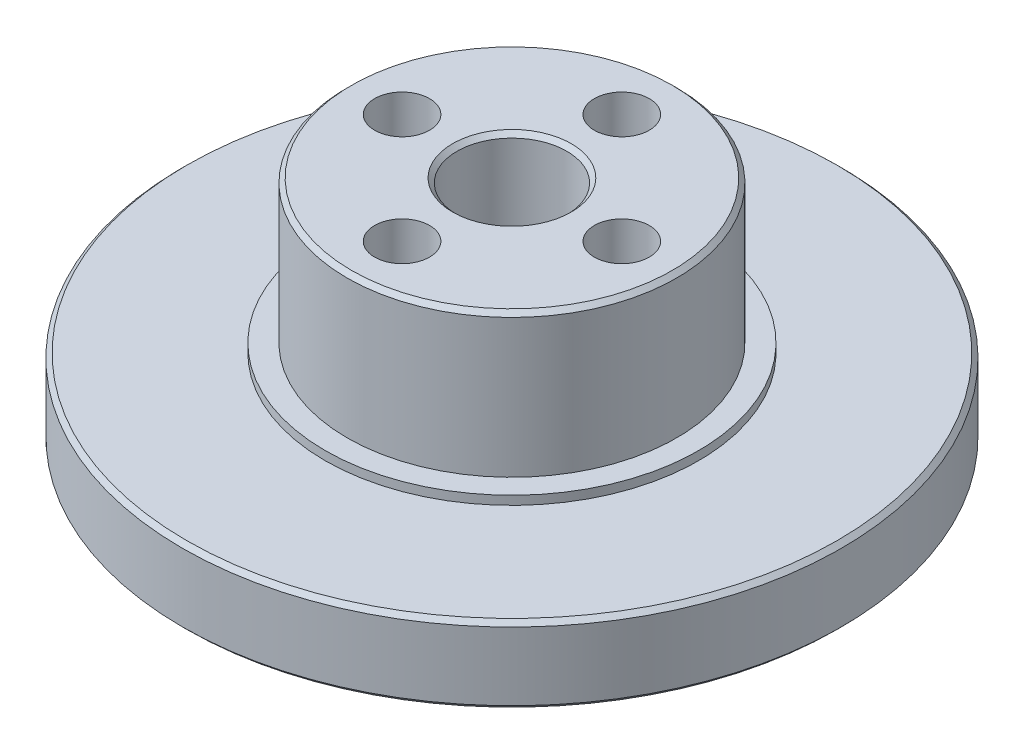
from build123d import *

# Parameters (mm, degrees)
SKETCH_1_R          = 15
SKETCH_1_R_2        = 2.075
EXTRUDE_1_DEPTH     = 2
SKETCH_2_R          = 15
EXTRUDE_2_DEPTH     = 1.5
SKETCH_3_R          = 8.5
EXTRUDE_3_DEPTH     = 0.4
SKETCH_4_R          = 7.5
EXTRUDE_4_DEPTH     = 6.5
SKETCH_5_R          = 1.25
SKETCH_5_R_2        = 2.5
CUT_EXTRUDE_1_DEPTH = 5
CHAMFER_1_SIZE      = 0.2
SKETCH_7_R          = 2.5
CUT_EXTRUDE_4_DEPTH = 22.889723616
SKETCH_8_R          = 6
CUT_EXTRUDE_5_DEPTH = 2
CHAMFER_2_SIZE      = 0.5


with BuildPart() as part:
    # 草图1 → 凸台-拉伸1 (new body)
    with BuildSketch(Plane(origin=(0, 0, 0), x_dir=(1, 0, 0), z_dir=(0, 1, 0))):
        Circle(SKETCH_1_R)
        with Locations((0, 11.525)):
            Circle(SKETCH_1_R_2, mode=Mode.SUBTRACT)
        with Locations((9.980942779, 5.7625)):
            Circle(SKETCH_1_R_2, mode=Mode.SUBTRACT)
        with Locations((9.980942779, -5.7625)):
            Circle(SKETCH_1_R_2, mode=Mode.SUBTRACT)
        with Locations((0, -11.525)):
            Circle(SKETCH_1_R_2, mode=Mode.SUBTRACT)
        with Locations((-9.980942779, -5.7625)):
            Circle(SKETCH_1_R_2, mode=Mode.SUBTRACT)
        with Locations((-9.980942779, 5.7625)):
            Circle(SKETCH_1_R_2, mode=Mode.SUBTRACT)
    extrude(amount=EXTRUDE_1_DEPTH)

    # 草图2 → 凸台-拉伸2 (add)
    with BuildSketch(Plane(origin=(0, 2, 0), x_dir=(1, 0, 0), z_dir=(0, 1, 0))):
        Circle(SKETCH_2_R)
    extrude(amount=EXTRUDE_2_DEPTH)

    # 草图3 → 凸台-拉伸3 (add)
    with BuildSketch(Plane(origin=(0, 3.5, 0), x_dir=(1, 0, 0), z_dir=(0, 1, 0))):
        Circle(SKETCH_3_R)
    extrude(amount=EXTRUDE_3_DEPTH)

    # 草图4 → 凸台-拉伸4 (add)
    with BuildSketch(Plane(origin=(0, 3.9, 0), x_dir=(1, 0, 0), z_dir=(0, 1, 0))):
        Circle(SKETCH_4_R)
    extrude(amount=EXTRUDE_4_DEPTH)

    # 草图5 → 切除-拉伸1 (cut)
    with BuildSketch(Plane(origin=(0, 10.4, 0), x_dir=(1, 0, 0), z_dir=(0, 1, 0))):
        with Locations((0, 5)):
            Circle(SKETCH_5_R)
        with Locations((5, 0)):
            Circle(SKETCH_5_R)
        with Locations((0, -5)):
            Circle(SKETCH_5_R)
        with Locations((-5, 0)):
            Circle(SKETCH_5_R)
        Circle(SKETCH_5_R_2)
    extrude(amount=-CUT_EXTRUDE_1_DEPTH, mode=Mode.SUBTRACT)

    # 倒角1
    chamfer_1_edges = [part.edges().sort_by_distance(p)[0] for p in [
        (-12.055942779, 0, -5.7625),
        (-12.055942779, 0, 5.7625),
        (-2.075, 0, 11.525),
        (7.905942779, 0, 5.7625),
        (7.905942779, 0, -5.7625),
        (-2.075, 0, -11.525),
        (-15, 0, 0),
        (-7.5, 10.4, 0),
        (-15, 3.5, 0),
        (-2.5, 10.4, 0),
    ]]
    chamfer(chamfer_1_edges, length=CHAMFER_1_SIZE)

    # 草图7 → 切除-拉伸4 (cut, through all)
    with BuildSketch(Plane(origin=(0, 5.4, 0), x_dir=(1, 0, 0), z_dir=(0, 1, 0))):
        Circle(SKETCH_7_R)
    extrude(amount=-CUT_EXTRUDE_4_DEPTH, mode=Mode.SUBTRACT)

    # 草图8 → 切除-拉伸5 (cut)
    with BuildSketch(Plane(origin=(0, 0, 0), x_dir=(-1, 0, 0), z_dir=(0, -1, 0))):
        Circle(SKETCH_8_R)
    extrude(amount=-CUT_EXTRUDE_5_DEPTH, mode=Mode.SUBTRACT)

    # 倒角2
    chamfer_2_edges = [part.edges().sort_by_distance(p)[0] for p in [
        (6, 0, 0),
        (-2.5, 2, 0),
        (6, 2, 0),
    ]]
    chamfer(chamfer_2_edges, length=CHAMFER_2_SIZE)


solid = part.part
